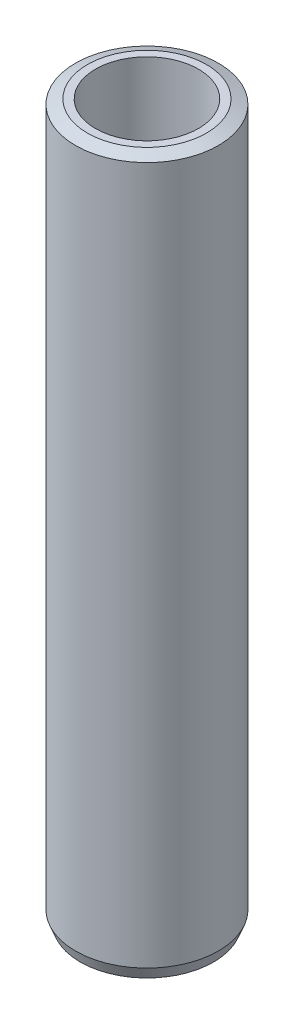
from build123d import *
from OCP.BRepFilletAPI import BRepFilletAPI_MakeChamfer

# Parameters (mm, degrees)
SKETCH1_R           = 60
BOSS_EXTRUDE1_DEPTH = 600
SKETCH2_R           = 43.255280125
CUT_EXTRUDE1_DEPTH  = 606.970296302
CHAMFER1_SIZE       = 3.992733967
CHAMFER1_SIZE2      = 10.039621399


with BuildPart() as part:
    # Sketch1 → Boss-Extrude1 (new body)
    with BuildSketch(Plane(origin=(0, 0, 0), x_dir=(1, 0, 0), z_dir=(0, 1, 0))):
        Circle(SKETCH1_R)
    extrude(amount=BOSS_EXTRUDE1_DEPTH)

    # Sketch2 → Cut-Extrude1 (cut, through all)
    with BuildSketch(Plane(origin=(0, 0, 0), x_dir=(1, 0, 0), z_dir=(0, 1, 0))):
        Circle(SKETCH2_R)
    extrude(amount=CUT_EXTRUDE1_DEPTH, mode=Mode.SUBTRACT)

    # Chamfer1: one chamfer whose edges measure the first distance from different faces: ONE call of the kernel's chamfer builder (chamfer() names one face for all edges)
    chamfer1_edges_1 = [part.edges().sort_by_distance(p)[0] for p in [
        (-60, 600, 0),
    ]]
    chamfer1_side_1 = [part.faces().sort_by_distance(p)[0] for p in [
        (-60, 300, 0),
    ]]
    chamfer1_edges_2 = [part.edges().sort_by_distance(p)[0] for p in [
        (-60, 0, 0),
    ]]
    chamfer1_side_2 = [part.faces().sort_by_distance(p)[0] for p in [
        (-58.302943725, 0, 0),
    ]]
    chamfer1 = BRepFilletAPI_MakeChamfer(part.part.solid().wrapped)
    for e in chamfer1_edges_1:
        chamfer1.Add(CHAMFER1_SIZE, CHAMFER1_SIZE2, e.wrapped, chamfer1_side_1[0].wrapped)  # the first distance lies on this face
    for e in chamfer1_edges_2:
        chamfer1.Add(CHAMFER1_SIZE, CHAMFER1_SIZE2, e.wrapped, chamfer1_side_2[0].wrapped)  # the first distance lies on this face
    add(Compound.cast(chamfer1.Shape()), mode=Mode.REPLACE)


solid = part.part
